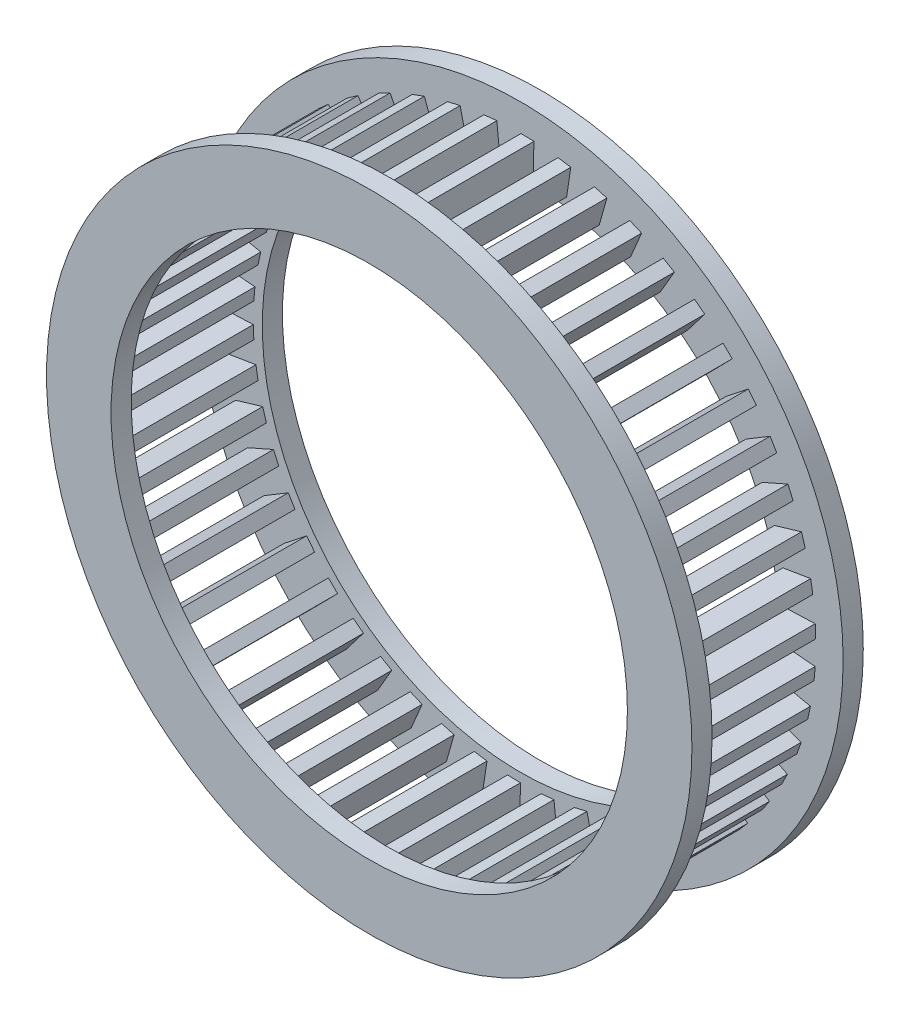
from build123d import *

# Parameters (mm, degrees)
CAGE_50_BARS_START    = -15.1
CAGE_50_BARS_DEPTH    = 30.2
CAGE_50_BARS_2_DEPTH  = 30.2
CAGE_50_BARS_3_DEPTH  = 30.2
CAGE_50_BARS_4_DEPTH  = 30.2
CAGE_50_BARS_5_DEPTH  = 30.2
CAGE_50_BARS_6_DEPTH  = 30.2
CAGE_50_BARS_7_DEPTH  = 30.2
CAGE_50_BARS_8_DEPTH  = 30.2
CAGE_50_BARS_9_DEPTH  = 30.2
CAGE_50_BARS_10_DEPTH = 30.2
CAGE_50_BARS_11_DEPTH = 30.2
CAGE_50_BARS_12_DEPTH = 30.2
CAGE_50_BARS_13_DEPTH = 30.2
CAGE_50_BARS_14_DEPTH = 30.2
CAGE_50_BARS_15_DEPTH = 30.2
CAGE_50_BARS_16_DEPTH = 30.2
CAGE_50_BARS_17_DEPTH = 30.2
CAGE_50_BARS_18_DEPTH = 30.2
CAGE_50_BARS_19_DEPTH = 30.2
CAGE_50_BARS_20_DEPTH = 30.2
CAGE_50_BARS_21_DEPTH = 30.2
CAGE_50_BARS_22_DEPTH = 30.2
CAGE_50_BARS_23_DEPTH = 30.2
CAGE_50_BARS_24_DEPTH = 30.2
CAGE_50_BARS_25_DEPTH = 30.2
CAGE_50_BARS_26_DEPTH = 30.2
CAGE_50_BARS_27_DEPTH = 30.2
CAGE_50_BARS_28_DEPTH = 30.2
CAGE_50_BARS_29_DEPTH = 30.2
CAGE_50_BARS_30_DEPTH = 30.2
CAGE_50_BARS_31_DEPTH = 30.2
CAGE_50_BARS_32_DEPTH = 30.2
CAGE_50_BARS_33_DEPTH = 30.2
CAGE_50_BARS_34_DEPTH = 30.2
CAGE_50_BARS_35_DEPTH = 30.2
CAGE_50_BARS_36_DEPTH = 30.2
CAGE_50_BARS_37_DEPTH = 30.2
CAGE_50_BARS_38_DEPTH = 30.2
CAGE_50_BARS_39_DEPTH = 30.2
CAGE_50_BARS_40_DEPTH = 30.2
CAGE_50_BARS_41_DEPTH = 30.2
CAGE_50_BARS_42_DEPTH = 30.2
CAGE_50_BARS_43_DEPTH = 30.2
CAGE_50_BARS_44_DEPTH = 30.2
CAGE_50_BARS_45_DEPTH = 30.2
CAGE_50_BARS_46_DEPTH = 30.2
CAGE_50_BARS_47_DEPTH = 30.2
CAGE_50_BARS_48_DEPTH = 30.2
CAGE_50_BARS_49_DEPTH = 30.2
CAGE_50_BARS_50_DEPTH = 30.2
CAGE_RING_RIGHT_START = 15
SKETCH_2_R            = 73.876923077
SKETCH_2_R_2          = 59.107692308
CAGE_RING_RIGHT_DEPTH = 4.615384615
CAGE_RING_LEFT_START  = -19.615384615
SKETCH_3_R            = 73.876923077
SKETCH_3_R_2          = 59.107692308
CAGE_RING_LEFT_DEPTH  = 4.615384615


with BuildPart() as part:
    # Эскиз1 → Cage_50_bars (new body)
    with BuildSketch(Plane.XY.offset(CAGE_50_BARS_START)):
        Polygon((61.149597151, 0.905289646), (67.606233377, 1.156940055), (67.49119319, 4.108545187), (61.034556964, 3.856894778), align=None)
    extrude(amount=CAGE_50_BARS_DEPTH)



with BuildPart() as body_2:
    # Эскиз1 → Cage_50_bars 2 (new body)
    with BuildSketch(Plane.XY.offset(CAGE_50_BARS_START)):
        Polygon((60.553951434, 8.562227908), (66.928134996, 9.621125076), (66.44406772, 12.535037561), (60.069884158, 11.476140394), align=None)
    extrude(amount=CAGE_50_BARS_2_DEPTH)


with BuildPart() as body_3:
    # Эскиз1 → Cage_50_bars 3 (new body)
    with BuildSketch(Plane.XY.offset(CAGE_50_BARS_START)):
        Polygon((59.00333373, 16.084134722), (65.194539945, 17.933579206), (64.349079609, 20.763844904), (58.157873395, 18.91440042), align=None)
    extrude(amount=CAGE_50_BARS_3_DEPTH)


with BuildPart() as body_4:
    # Эскиз1 → Cage_50_bars 4 (new body)
    with BuildSketch(Plane.XY.offset(CAGE_50_BARS_START)):
        Polygon((56.522198207, 23.352385123), (62.432788053, 25.96321008), (61.239268073, 28.66519401), (55.328678227, 26.054369053), align=None)
    extrude(amount=CAGE_50_BARS_4_DEPTH)


with BuildPart() as body_5:
    # Эскиз1 → Cage_50_bars 5 (new body)
    with BuildSketch(Plane.XY.offset(CAGE_50_BARS_START)):
        Polygon((53.149673853, 30.252354461), (58.686433799, 33.583385621), (57.163676697, 36.114475882), (51.626916751, 32.783444722), align=None)
    extrude(amount=CAGE_50_BARS_5_DEPTH)


with BuildPart() as body_6:
    # Эскиз1 → Cage_50_bars 6 (new body)
    with BuildSketch(Plane.XY.offset(CAGE_50_BARS_START)):
        Polygon((48.938947392, 36.675226097), (54.014559426, 40.673931109), (52.186579992, 42.994210896), (47.110967958, 38.995505884), align=None)
    extrude(amount=CAGE_50_BARS_6_DEPTH)


with BuildPart() as body_7:
    # Эскиз1 → Cage_50_bars 7 (new body)
    with BuildSketch(Plane.XY.offset(CAGE_50_BARS_START)):
        Polygon((43.956424496, 42.519707509), (48.490843184, 47.123024405), (46.386469745, 49.19590152), (41.852051057, 44.592584623), align=None)
    extrude(amount=CAGE_50_BARS_7_DEPTH)


with BuildPart() as body_8:
    # Эскиз1 → Cage_50_bars 8 (new body)
    with BuildSketch(Plane.XY.offset(CAGE_50_BARS_START)):
        Polygon((38.280682527, 47.693627733), (42.202397378, 52.828959458), (39.854817161, 54.621743389), (35.93310231, 49.486411665), align=None)
    extrude(amount=CAGE_50_BARS_8_DEPTH)


with BuildPart() as body_9:
    # Эскиз1 → Cage_50_bars 9 (new body)
    with BuildSketch(Plane.XY.offset(CAGE_50_BARS_START)):
        Polygon((32.001231327, 52.115390957), (35.248394554, 57.70175026), (32.694630301, 59.186167736), (29.447467074, 53.599808432), align=None)
    extrude(amount=CAGE_50_BARS_9_DEPTH)


with BuildPart() as body_10:
    # Эскиз1 → Cage_50_bars 10 (new body)
    with BuildSketch(Plane.XY.offset(CAGE_50_BARS_START)):
        Polygon((25.217101593, 55.715263334), (27.738503493, 61.664549992), (25.018829591, 62.817190861), (22.497427692, 56.867904202), align=None)
    extrude(amount=CAGE_50_BARS_10_DEPTH)


with BuildPart() as body_11:
    # Эскиз1 → Cage_50_bars 11 (new body)
    with BuildSketch(Plane.XY.offset(CAGE_50_BARS_START)):
        Polygon((18.035283102, 58.436472725), (19.791159661, 64.654862934), (16.948466993, 65.457549361), (15.192590435, 59.239159151), align=None)
    extrude(amount=CAGE_50_BARS_11_DEPTH)


with BuildPart() as body_12:
    # Эскиз1 → Cage_50_bars 12 (new body)
    with BuildSketch(Plane.XY.offset(CAGE_50_BARS_START)):
        Polygon((10.569037424, 60.236104032), (11.531697418, 66.625530065), (8.610816946, 67.065603205), (7.648156952, 60.676177173), align=None)
    extrude(amount=CAGE_50_BARS_12_DEPTH)


with BuildPart() as body_13:
    # Эскиз1 → Cage_50_bars 13 (new body)
    with BuildSketch(Plane.XY.offset(CAGE_50_BARS_START)):
        Polygon((2.936111711, 61.085775996), (3.090373419, 67.545472786), (0.137369172, 67.615992424), (-0.016892536, 61.156295634), align=None)
    extrude(amount=CAGE_50_BARS_13_DEPTH)


with BuildPart() as body_14:
    # Эскиз1 → Cage_50_bars 14 (new body)
    with BuildSketch(Plane.XY.offset(CAGE_50_BARS_START)):
        Polygon((-4.743118237, 60.972088782), (-5.399687616, 67.400183052), (-8.338244996, 67.10003705), (-7.681675618, 60.671942781), align=None)
    extrude(amount=CAGE_50_BARS_14_DEPTH)


with BuildPart() as body_15:
    # Эскиз1 → Cage_50_bars 15 (new body)
    with BuildSketch(Plane.XY.offset(CAGE_50_BARS_START)):
        Polygon((-12.347546378, 59.896835305), (-13.804592351, 66.191952168), (-16.68236006, 65.525874009), (-15.225314086, 59.230757146), align=None)
    extrude(amount=CAGE_50_BARS_15_DEPTH)


with BuildPart() as body_16:
    # Эскиз1 → Cage_50_bars 16 (new body)
    with BuildSketch(Plane.XY.offset(CAGE_50_BARS_START)):
        Polygon((-19.757246335, 57.876972954), (-21.991790418, 63.939834657), (-24.763384339, 62.918328791), (-22.528840257, 56.855467088), align=None)
    extrude(amount=CAGE_50_BARS_16_DEPTH)


with BuildPart() as body_17:
    # Эскиз1 → Cage_50_bars 17 (new body)
    with BuildSketch(Plane.XY.offset(CAGE_50_BARS_START)):
        Polygon((-26.855362716, 54.944356166), (-29.832164813, 60.679347758), (-32.453875255, 59.318523942), (-29.477073158, 53.58353235), align=None)
    extrude(amount=CAGE_50_BARS_17_DEPTH)


with BuildPart() as body_18:
    # Эскиз1 → Cage_50_bars 18 (new body)
    with BuildSketch(Plane.XY.offset(CAGE_50_BARS_START)):
        Polygon((-33.529953984, 51.145234058), (-37.202068148, 56.461911297), (-39.632549171, 54.783230536), (-35.960435007, 49.466553298), align=None)
    extrude(amount=CAGE_50_BARS_18_DEPTH)


with BuildPart() as body_19:
    # Эскиз1 → Cage_50_bars 19 (new body)
    with BuildSketch(Plane.XY.offset(CAGE_50_BARS_START)):
        Polygon((-39.675757848, 46.539521057), (-43.985272645, 51.354036765), (-46.186194112, 49.383972858), (-41.876679314, 44.56945715), align=None)
    extrude(amount=CAGE_50_BARS_19_DEPTH)


with BuildPart() as body_20:
    # Эскиз1 → Cage_50_bars 20 (new body)
    with BuildSketch(Plane.XY.offset(CAGE_50_BARS_START)):
        Polygon((-45.195851309, 41.199852008), (-50.074803117, 45.436278397), (-52.01145518, 43.205900428), (-47.132503373, 38.969474039), align=None)
    extrude(amount=CAGE_50_BARS_20_DEPTH)


with BuildPart() as body_21:
    # Эскиз1 → Cage_50_bars 21 (new body)
    with BuildSketch(Plane.XY.offset(CAGE_50_BARS_START)):
        Polygon((-50.003179197, 35.210436681), (-55.37462403, 38.801962776), (-57.016464531, 36.346445138), (-51.645019698, 32.754919043), align=None)
    extrude(amount=CAGE_50_BARS_21_DEPTH)


with BuildPart() as body_22:
    # Эскиз1 → Cage_50_bars 22 (new body)
    with BuildSketch(Plane.XY.offset(CAGE_50_BARS_START)):
        Polygon((-54.021927078, 28.665731734), (-59.801154044, 31.555717023), (-61.122290176, 28.913784696), (-55.34306321, 26.023799407), align=None)
    extrude(amount=CAGE_50_BARS_22_DEPTH)


with BuildPart() as body_23:
    # Эскиз1 → Cage_50_bars 23 (new body)
    with BuildSketch(Plane.XY.offset(CAGE_50_BARS_START)):
        Polygon((-57.188716898, 21.668951073), (-63.284584134, 23.811818762), (-64.264180792, 21.025136597), (-58.168313556, 18.882268908), align=None)
    extrude(amount=CAGE_50_BARS_23_DEPTH)


with BuildPart() as body_24:
    # Эскиз1 → Cage_50_bars 24 (new body)
    with BuildSketch(Plane.XY.offset(CAGE_50_BARS_START)):
        Polygon((-59.45360649, 14.330438109), (-65.769978529, 15.692393894), (-66.392586887, 12.804909534), (-60.076214849, 11.442953749), align=None)
    extrude(amount=CAGE_50_BARS_24_DEPTH)


with BuildPart() as body_25:
    # Эскиз1 → Cage_50_bars 25 (new body)
    with BuildSketch(Plane.XY.offset(CAGE_50_BARS_START)):
        Polygon((-60.780877191, 6.765925576), (-67.218141072, 7.325490601), (-67.473942227, 4.382741398), (-61.036678346, 3.823176373), align=None)
    extrude(amount=CAGE_50_BARS_25_DEPTH)


with BuildPart() as body_26:
    # Эскиз1 → Cage_50_bars 26 (new body)
    with BuildSketch(Plane.XY.offset(CAGE_50_BARS_START)):
        Polygon((-61.149597151, -0.905289646), (-67.606233377, -1.156940055), (-67.49119319, -4.108545187), (-61.034556964, -3.856894778), align=None)
    extrude(amount=CAGE_50_BARS_26_DEPTH)


with BuildPart() as body_27:
    # Эскиз1 → Cage_50_bars 27 (new body)
    with BuildSketch(Plane.XY.offset(CAGE_50_BARS_START)):
        Polygon((-60.553951434, -8.562227908), (-66.928134996, -9.621125076), (-66.44406772, -12.535037561), (-60.069884158, -11.476140394), align=None)
    extrude(amount=CAGE_50_BARS_27_DEPTH)


with BuildPart() as body_28:
    # Эскиз1 → Cage_50_bars 28 (new body)
    with BuildSketch(Plane.XY.offset(CAGE_50_BARS_START)):
        Polygon((-59.00333373, -16.084134722), (-65.194539945, -17.933579206), (-64.349079609, -20.763844904), (-58.157873395, -18.91440042), align=None)
    extrude(amount=CAGE_50_BARS_28_DEPTH)


with BuildPart() as body_29:
    # Эскиз1 → Cage_50_bars 29 (new body)
    with BuildSketch(Plane.XY.offset(CAGE_50_BARS_START)):
        Polygon((-56.522198207, -23.352385123), (-62.432788053, -25.96321008), (-61.239268073, -28.66519401), (-55.328678227, -26.054369053), align=None)
    extrude(amount=CAGE_50_BARS_29_DEPTH)


with BuildPart() as body_30:
    # Эскиз1 → Cage_50_bars 30 (new body)
    with BuildSketch(Plane.XY.offset(CAGE_50_BARS_START)):
        Polygon((-53.149673853, -30.252354461), (-58.686433799, -33.583385621), (-57.163676697, -36.114475882), (-51.626916751, -32.783444722), align=None)
    extrude(amount=CAGE_50_BARS_30_DEPTH)


with BuildPart() as body_31:
    # Эскиз1 → Cage_50_bars 31 (new body)
    with BuildSketch(Plane.XY.offset(CAGE_50_BARS_START)):
        Polygon((-48.938947392, -36.675226097), (-54.014559426, -40.673931109), (-52.186579992, -42.994210896), (-47.110967958, -38.995505884), align=None)
    extrude(amount=CAGE_50_BARS_31_DEPTH)


with BuildPart() as body_32:
    # Эскиз1 → Cage_50_bars 32 (new body)
    with BuildSketch(Plane.XY.offset(CAGE_50_BARS_START)):
        Polygon((-43.956424496, -42.519707509), (-48.490843184, -47.123024405), (-46.386469745, -49.19590152), (-41.852051057, -44.592584623), align=None)
    extrude(amount=CAGE_50_BARS_32_DEPTH)


with BuildPart() as body_33:
    # Эскиз1 → Cage_50_bars 33 (new body)
    with BuildSketch(Plane.XY.offset(CAGE_50_BARS_START)):
        Polygon((-38.280682527, -47.693627733), (-42.202397378, -52.828959458), (-39.854817161, -54.621743389), (-35.93310231, -49.486411665), align=None)
    extrude(amount=CAGE_50_BARS_33_DEPTH)


with BuildPart() as body_34:
    # Эскиз1 → Cage_50_bars 34 (new body)
    with BuildSketch(Plane.XY.offset(CAGE_50_BARS_START)):
        Polygon((-32.001231327, -52.115390957), (-35.248394554, -57.70175026), (-32.694630301, -59.186167736), (-29.447467074, -53.599808432), align=None)
    extrude(amount=CAGE_50_BARS_34_DEPTH)


with BuildPart() as body_35:
    # Эскиз1 → Cage_50_bars 35 (new body)
    with BuildSketch(Plane.XY.offset(CAGE_50_BARS_START)):
        Polygon((-25.217101593, -55.715263334), (-27.738503493, -61.664549992), (-25.018829591, -62.817190861), (-22.497427692, -56.867904202), align=None)
    extrude(amount=CAGE_50_BARS_35_DEPTH)


with BuildPart() as body_36:
    # Эскиз1 → Cage_50_bars 36 (new body)
    with BuildSketch(Plane.XY.offset(CAGE_50_BARS_START)):
        Polygon((-18.035283102, -58.436472725), (-19.791159661, -64.654862934), (-16.948466993, -65.457549361), (-15.192590435, -59.239159151), align=None)
    extrude(amount=CAGE_50_BARS_36_DEPTH)


with BuildPart() as body_37:
    # Эскиз1 → Cage_50_bars 37 (new body)
    with BuildSketch(Plane.XY.offset(CAGE_50_BARS_START)):
        Polygon((-10.569037424, -60.236104032), (-11.531697418, -66.625530065), (-8.610816946, -67.065603205), (-7.648156952, -60.676177173), align=None)
    extrude(amount=CAGE_50_BARS_37_DEPTH)


with BuildPart() as body_38:
    # Эскиз1 → Cage_50_bars 38 (new body)
    with BuildSketch(Plane.XY.offset(CAGE_50_BARS_START)):
        Polygon((-2.936111711, -61.085775996), (-3.090373419, -67.545472786), (-0.137369172, -67.615992424), (0.016892536, -61.156295634), align=None)
    extrude(amount=CAGE_50_BARS_38_DEPTH)


with BuildPart() as body_39:
    # Эскиз1 → Cage_50_bars 39 (new body)
    with BuildSketch(Plane.XY.offset(CAGE_50_BARS_START)):
        Polygon((4.743118237, -60.972088782), (5.399687616, -67.400183052), (8.338244996, -67.10003705), (7.681675618, -60.671942781), align=None)
    extrude(amount=CAGE_50_BARS_39_DEPTH)


with BuildPart() as body_40:
    # Эскиз1 → Cage_50_bars 40 (new body)
    with BuildSketch(Plane.XY.offset(CAGE_50_BARS_START)):
        Polygon((12.347546378, -59.896835305), (13.804592351, -66.191952168), (16.68236006, -65.525874009), (15.225314086, -59.230757146), align=None)
    extrude(amount=CAGE_50_BARS_40_DEPTH)


with BuildPart() as body_41:
    # Эскиз1 → Cage_50_bars 41 (new body)
    with BuildSketch(Plane.XY.offset(CAGE_50_BARS_START)):
        Polygon((19.757246335, -57.876972954), (21.991790418, -63.939834657), (24.763384339, -62.918328791), (22.528840257, -56.855467088), align=None)
    extrude(amount=CAGE_50_BARS_41_DEPTH)


with BuildPart() as body_42:
    # Эскиз1 → Cage_50_bars 42 (new body)
    with BuildSketch(Plane.XY.offset(CAGE_50_BARS_START)):
        Polygon((26.855362716, -54.944356166), (29.832164813, -60.679347758), (32.453875255, -59.318523942), (29.477073158, -53.58353235), align=None)
    extrude(amount=CAGE_50_BARS_42_DEPTH)


with BuildPart() as body_43:
    # Эскиз1 → Cage_50_bars 43 (new body)
    with BuildSketch(Plane.XY.offset(CAGE_50_BARS_START)):
        Polygon((33.529953984, -51.145234058), (37.202068148, -56.461911297), (39.632549171, -54.783230536), (35.960435007, -49.466553298), align=None)
    extrude(amount=CAGE_50_BARS_43_DEPTH)


with BuildPart() as body_44:
    # Эскиз1 → Cage_50_bars 44 (new body)
    with BuildSketch(Plane.XY.offset(CAGE_50_BARS_START)):
        Polygon((39.675757848, -46.539521057), (43.985272645, -51.354036765), (46.186194112, -49.383972858), (41.876679314, -44.56945715), align=None)
    extrude(amount=CAGE_50_BARS_44_DEPTH)


with BuildPart() as body_45:
    # Эскиз1 → Cage_50_bars 45 (new body)
    with BuildSketch(Plane.XY.offset(CAGE_50_BARS_START)):
        Polygon((45.195851309, -41.199852008), (50.074803117, -45.436278397), (52.01145518, -43.205900428), (47.132503373, -38.969474039), align=None)
    extrude(amount=CAGE_50_BARS_45_DEPTH)


with BuildPart() as body_46:
    # Эскиз1 → Cage_50_bars 46 (new body)
    with BuildSketch(Plane.XY.offset(CAGE_50_BARS_START)):
        Polygon((50.003179197, -35.210436681), (55.37462403, -38.801962776), (57.016464531, -36.346445138), (51.645019698, -32.754919043), align=None)
    extrude(amount=CAGE_50_BARS_46_DEPTH)


with BuildPart() as body_47:
    # Эскиз1 → Cage_50_bars 47 (new body)
    with BuildSketch(Plane.XY.offset(CAGE_50_BARS_START)):
        Polygon((54.021927078, -28.665731734), (59.801154044, -31.555717023), (61.122290176, -28.913784696), (55.34306321, -26.023799407), align=None)
    extrude(amount=CAGE_50_BARS_47_DEPTH)


with BuildPart() as body_48:
    # Эскиз1 → Cage_50_bars 48 (new body)
    with BuildSketch(Plane.XY.offset(CAGE_50_BARS_START)):
        Polygon((57.188716898, -21.668951073), (63.284584134, -23.811818762), (64.264180792, -21.025136597), (58.168313556, -18.882268908), align=None)
    extrude(amount=CAGE_50_BARS_48_DEPTH)


with BuildPart() as body_49:
    # Эскиз1 → Cage_50_bars 49 (new body)
    with BuildSketch(Plane.XY.offset(CAGE_50_BARS_START)):
        Polygon((59.45360649, -14.330438109), (65.769978529, -15.692393894), (66.392586887, -12.804909534), (60.076214849, -11.442953749), align=None)
    extrude(amount=CAGE_50_BARS_49_DEPTH)


with BuildPart() as body_50:
    # Эскиз1 → Cage_50_bars 50 (new body)
    with BuildSketch(Plane.XY.offset(CAGE_50_BARS_START)):
        Polygon((60.780877191, -6.765925576), (67.218141072, -7.325490601), (67.473942227, -4.382741398), (61.036678346, -3.823176373), align=None)
    extrude(amount=CAGE_50_BARS_50_DEPTH)


with BuildPart() as part_1:
    add(part.part)

    add(body_2.part)  # Cage_ring_right merges body 2

    add(body_3.part)  # Cage_ring_right merges body 3

    add(body_4.part)  # Cage_ring_right merges body 4

    add(body_5.part)  # Cage_ring_right merges body 5

    add(body_6.part)  # Cage_ring_right merges body 6

    add(body_7.part)  # Cage_ring_right merges body 7

    add(body_8.part)  # Cage_ring_right merges body 8

    add(body_9.part)  # Cage_ring_right merges body 9

    add(body_10.part)  # Cage_ring_right merges body 10

    add(body_11.part)  # Cage_ring_right merges body 11

    add(body_12.part)  # Cage_ring_right merges body 12

    add(body_13.part)  # Cage_ring_right merges body 13

    add(body_14.part)  # Cage_ring_right merges body 14

    add(body_15.part)  # Cage_ring_right merges body 15

    add(body_16.part)  # Cage_ring_right merges body 16

    add(body_17.part)  # Cage_ring_right merges body 17

    add(body_18.part)  # Cage_ring_right merges body 18

    add(body_19.part)  # Cage_ring_right merges body 19

    add(body_20.part)  # Cage_ring_right merges body 20

    add(body_21.part)  # Cage_ring_right merges body 21

    add(body_22.part)  # Cage_ring_right merges body 22

    add(body_23.part)  # Cage_ring_right merges body 23

    add(body_24.part)  # Cage_ring_right merges body 24

    add(body_25.part)  # Cage_ring_right merges body 25

    add(body_26.part)  # Cage_ring_right merges body 26

    add(body_27.part)  # Cage_ring_right merges body 27

    add(body_28.part)  # Cage_ring_right merges body 28

    add(body_29.part)  # Cage_ring_right merges body 29

    add(body_30.part)  # Cage_ring_right merges body 30

    add(body_31.part)  # Cage_ring_right merges body 31

    add(body_32.part)  # Cage_ring_right merges body 32

    add(body_33.part)  # Cage_ring_right merges body 33

    add(body_34.part)  # Cage_ring_right merges body 34

    add(body_35.part)  # Cage_ring_right merges body 35

    add(body_36.part)  # Cage_ring_right merges body 36

    add(body_37.part)  # Cage_ring_right merges body 37

    add(body_38.part)  # Cage_ring_right merges body 38

    add(body_39.part)  # Cage_ring_right merges body 39

    add(body_40.part)  # Cage_ring_right merges body 40

    add(body_41.part)  # Cage_ring_right merges body 41

    add(body_42.part)  # Cage_ring_right merges body 42

    add(body_43.part)  # Cage_ring_right merges body 43

    add(body_44.part)  # Cage_ring_right merges body 44

    add(body_45.part)  # Cage_ring_right merges body 45

    add(body_46.part)  # Cage_ring_right merges body 46

    add(body_47.part)  # Cage_ring_right merges body 47

    add(body_48.part)  # Cage_ring_right merges body 48

    add(body_49.part)  # Cage_ring_right merges body 49

    add(body_50.part)  # Cage_ring_right merges body 50
    # Эскиз2 → Cage_ring_right (add)
    with BuildSketch(Plane.XY.offset(CAGE_RING_RIGHT_START)):
        Circle(SKETCH_2_R)
        Circle(SKETCH_2_R_2, mode=Mode.SUBTRACT)
    extrude(amount=CAGE_RING_RIGHT_DEPTH)

    # Эскиз3 → Cage_ring_left (add)
    with BuildSketch(Plane.XY.offset(CAGE_RING_LEFT_START)):
        Circle(SKETCH_3_R)
        Circle(SKETCH_3_R_2, mode=Mode.SUBTRACT)
    extrude(amount=CAGE_RING_LEFT_DEPTH)


solid = part_1.part
